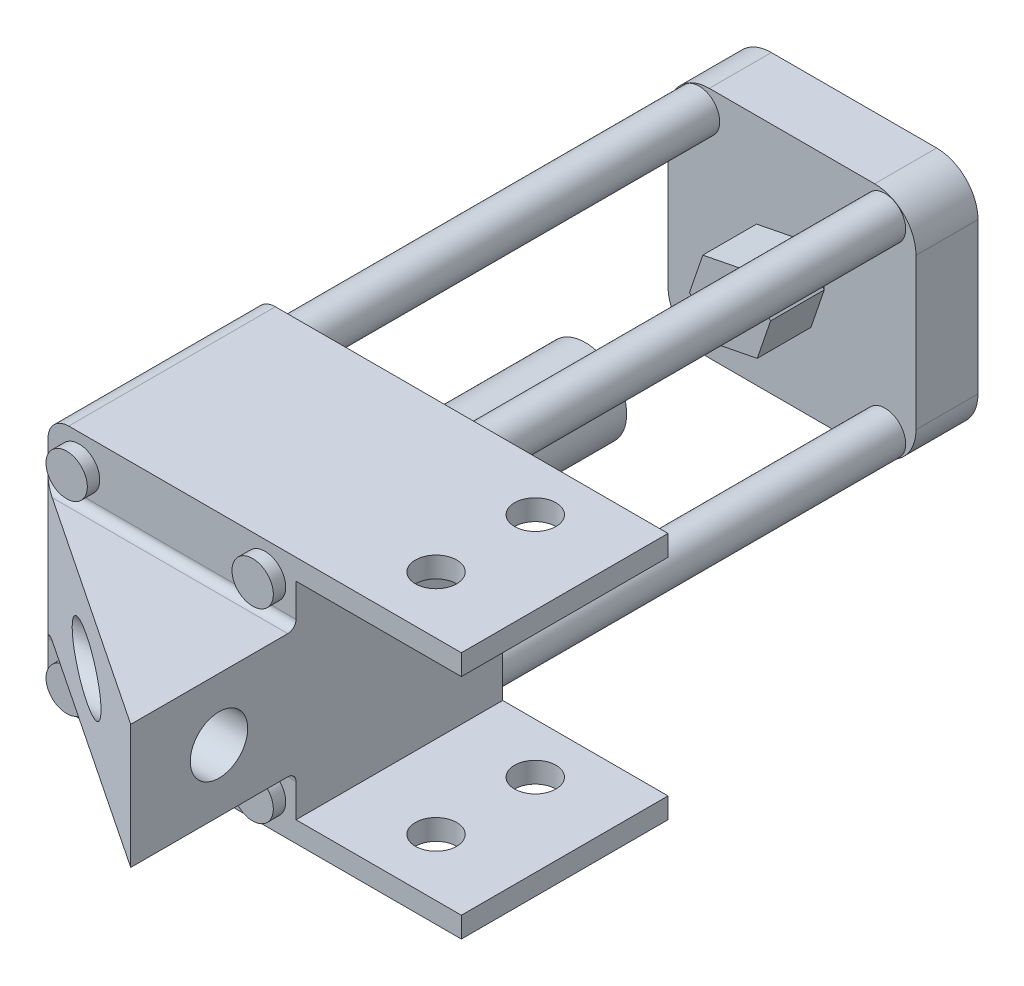
from build123d import *

# Parameters (mm, degrees)
IZIM1_W                          = 60
IZIM1_H                          = 60
Y_KSEKLIK_EKSTR_ZYON1_DEPTH      = 50
IZIM2_R                          = 10
Y_KSEKLIK_EKSTR_ZYON2_DEPTH      = 50
IZIM3_R                          = 4.482666428
Y_KSEKLIK_EKSTR_ZYON3_DEPTH      = 35
Y_KSEKLIK_EKSTR_ZYON4_DEPTH      = 15
PAH1_SIZE                        = 2
Y_KSEKLIK_EKSTR_ZYON7_DEPTH      = 100
Y_KSEKLIK_EKSTR_ZYON7_DEPTH_BACK = 53
IZIM8_R                          = 5
IZIM9_W                          = 60
IZIM9_H                          = 56.52547631
Y_KSEKLIK_EKSTR_ZYON8_DEPTH      = 15
RADYUS2_R                        = 10
Y_KSEKLIK_EKSTR_ZYON9_DEPTH      = 15
Y_KSEKLIK_EKSTR_ZYON9_DEPTH_BACK = 15
IZIM11_R                         = 6.953917593
KES_EKSTR_ZYON1_DEPTH            = 75
RADYUS3_R                        = 5
IZIM12_W                         = 45
IZIM12_H                         = 50
Y_KSEKLIK_EKSTR_ZYON10_DEPTH     = 5
IZIM13_W                         = 45
IZIM13_H                         = 50
Y_KSEKLIK_EKSTR_ZYON11_DEPTH     = 5
IZIM14_R                         = 5
KES_EKSTR_ZYON2_DEPTH            = 98
RADYUS4_R                        = 2


with BuildPart() as part:
    # Çizim1 → Yükseklik-Ekstrüzyon1 (new body)
    with BuildSketch(Plane.XY):
        Rectangle(IZIM1_W, IZIM1_H)
    extrude(amount=Y_KSEKLIK_EKSTR_ZYON1_DEPTH)

    # Çizim2 → Yükseklik-Ekstrüzyon2 (add)
    with BuildSketch(Plane(origin=(0, 0, 0), x_dir=(-1, 0, 0), z_dir=(0, 0, -1))):
        Circle(IZIM2_R)
    extrude(amount=Y_KSEKLIK_EKSTR_ZYON2_DEPTH)

    # Çizim3 → Yükseklik-Ekstrüzyon3 (add)
    with BuildSketch(Plane(origin=(0, 0, -50), x_dir=(-1, 0, 0), z_dir=(0, 0, -1))):
        Circle(IZIM3_R)
    extrude(amount=Y_KSEKLIK_EKSTR_ZYON3_DEPTH)

    # Çizim4 → Yükseklik-Ekstrüzyon4 (add)
    with BuildSketch(Plane(origin=(0, 0, -85), x_dir=(-1, 0, 0), z_dir=(0, 0, -1))):
        Polygon((9.810169594, -1.939219571), (6.584498209, 7.526246298), (-3.225671385, 9.465465869), (-9.810169594, 1.939219571), (-6.584498209, -7.526246298), (3.225671385, -9.465465869), align=None)
    extrude(amount=Y_KSEKLIK_EKSTR_ZYON4_DEPTH)

    # Pah1
    pah1_edges = [part.edges().sort_by_distance(p)[0] for p in [
        (-6.517920489, -5.70234272, -100),
        (-8.197333901, 2.793513364, -100),
        (-1.679413412, 8.495856084, -100),
        (6.517920489, 5.70234272, -100),
        (8.197333901, -2.793513364, -100),
        (1.679413412, -8.495856084, -100),
    ]]
    chamfer(pah1_edges, length=PAH1_SIZE)

    # Çizim8 → Yükseklik-Ekstrüzyon7 (add, two sides: drawn at the far end of the back side and taken through both)
    with BuildSketch(Plane(origin=(0, 0, 0), x_dir=(-1, 0, 0), z_dir=(0, 0, -1)).offset(-Y_KSEKLIK_EKSTR_ZYON7_DEPTH_BACK)):
        with Locations((-22.5, 22.5)):
            Circle(IZIM8_R)
        with Locations((22.5, 22.5)):
            Circle(IZIM8_R)
        with Locations((22.5, -22.5)):
            Circle(IZIM8_R)
        with Locations((-22.5, -22.5)):
            Circle(IZIM8_R)
    extrude(amount=Y_KSEKLIK_EKSTR_ZYON7_DEPTH + Y_KSEKLIK_EKSTR_ZYON7_DEPTH_BACK)

    # Çizim9 → Yükseklik-Ekstrüzyon8 (add)
    with BuildSketch(Plane(origin=(0, 0, -100), x_dir=(-1, 0, 0), z_dir=(0, 0, -1))):
        Rectangle(IZIM9_W, IZIM9_H)
    extrude(amount=Y_KSEKLIK_EKSTR_ZYON8_DEPTH)

    # Radyus2
    radyus2_edges = [part.edges().sort_by_distance(p)[0] for p in [
        (30, 28.262738155, -107.5),
        (30, -28.262738155, -107.5),
        (-30, -28.262738155, -107.5),
        (-30, 28.262738155, -107.5),
    ]]
    fillet(radyus2_edges, radius=RADYUS2_R)

    # Çizim10 → Yükseklik-Ekstrüzyon9 (add, two sides: drawn at the far end of the back side and taken through both)
    with BuildSketch(Plane(origin=(0, 0, 0), x_dir=(1, 0, 0), z_dir=(0, 1, 0)).offset(-Y_KSEKLIK_EKSTR_ZYON9_DEPTH_BACK)):
        Polygon((30, -50), (30, -90), (-30, -50), align=None)
    extrude(amount=Y_KSEKLIK_EKSTR_ZYON9_DEPTH + Y_KSEKLIK_EKSTR_ZYON9_DEPTH_BACK)

    # Çizim11 → Kes-Ekstrüzyon1 (cut)
    with BuildSketch(Plane(origin=(30, 0, 0), x_dir=(0, 0, -1), z_dir=(1, 0, 0))):
        with Locations(Location((-68.644638819, 0, 0), (0, 0, 90))):
            Circle(IZIM11_R)
    extrude(amount=-KES_EKSTR_ZYON1_DEPTH, mode=Mode.SUBTRACT)

    # Radyus3
    radyus3_edges = [part.edges().sort_by_distance(p)[0] for p in [
        (-30, 30, 25),
        (30, 30, 25),
        (30, -30, 25),
        (-30, -30, 25),
    ]]
    fillet(radyus3_edges, radius=RADYUS3_R)

    # Çizim12 → Yükseklik-Ekstrüzyon10 (add)
    with BuildSketch(Plane.XZ.offset(30)):
        with Locations((47.5, 25)):
            Rectangle(IZIM12_W, IZIM12_H)
    extrude(amount=-Y_KSEKLIK_EKSTR_ZYON10_DEPTH)

    # Çizim13 → Yükseklik-Ekstrüzyon11 (add)
    with BuildSketch(Plane(origin=(0, 30, 0), x_dir=(1, 0, 0), z_dir=(0, 1, 0))):
        with Locations((47.5, -25)):
            Rectangle(IZIM13_W, IZIM13_H)
    extrude(amount=-Y_KSEKLIK_EKSTR_ZYON11_DEPTH)

    # Çizim14 → Kes-Ekstrüzyon2 (cut)
    with BuildSketch(Plane(origin=(0, 30, 0), x_dir=(1, 0, 0), z_dir=(0, 1, 0))):
        with Locations(Location((50, -12.123765205, 0), (0, 0, 180))):
            Circle(IZIM14_R)
        with Locations(Location((50, -36.123765205, 0), (0, 0, 180))):
            Circle(IZIM14_R)
    extrude(amount=-KES_EKSTR_ZYON2_DEPTH, mode=Mode.SUBTRACT)

    # Radyus4
    # the kernel refuses this fillet: 2 mm, written as the material it adds along each edge
    with BuildSketch(Plane(origin=(-30, -15, 50), x_dir=(0, -1, 0), z_dir=(1, 0, 0))) as radyus4_piece_1_section:
        with BuildLine():
            CenterArc((RADYUS4_R, -RADYUS4_R), RADYUS4_R, 90, 90)
            Line((0, -RADYUS4_R), (0, 0))
            Line((0, 0), (RADYUS4_R, 0))
        make_face()
    radyus4_piece_1 = extrude(amount=60, mode=Mode.PRIVATE)
    radyus4_piece_1 = split(radyus4_piece_1, bisect_by=Plane(origin=(-8.790437834, -15.455546118, 64.139708111), z_dir=(0.5547001962252291, 0, -0.8320502943378437)), keep=Keep.TOP, mode=Mode.PRIVATE)
    add(radyus4_piece_1)
    with BuildSketch(Plane(origin=(-30, 15, 50), x_dir=(0, 1, 0), z_dir=(1, 0, 0))) as radyus4_piece_2_section:
        with BuildLine():
            CenterArc((RADYUS4_R, RADYUS4_R), RADYUS4_R, 180, 90)
            Line((0, RADYUS4_R), (0, 0))
            Line((0, 0), (RADYUS4_R, 0))
        make_face()
    radyus4_piece_2 = extrude(amount=60, mode=Mode.PRIVATE)
    radyus4_piece_2 = split(radyus4_piece_2, bisect_by=Plane(origin=(-8.790437834, 15.455546118, 64.139708111), z_dir=(0.5547001962252291, 0, -0.8320502943378437)), keep=Keep.TOP, mode=Mode.PRIVATE)
    add(radyus4_piece_2)


solid = part.part
